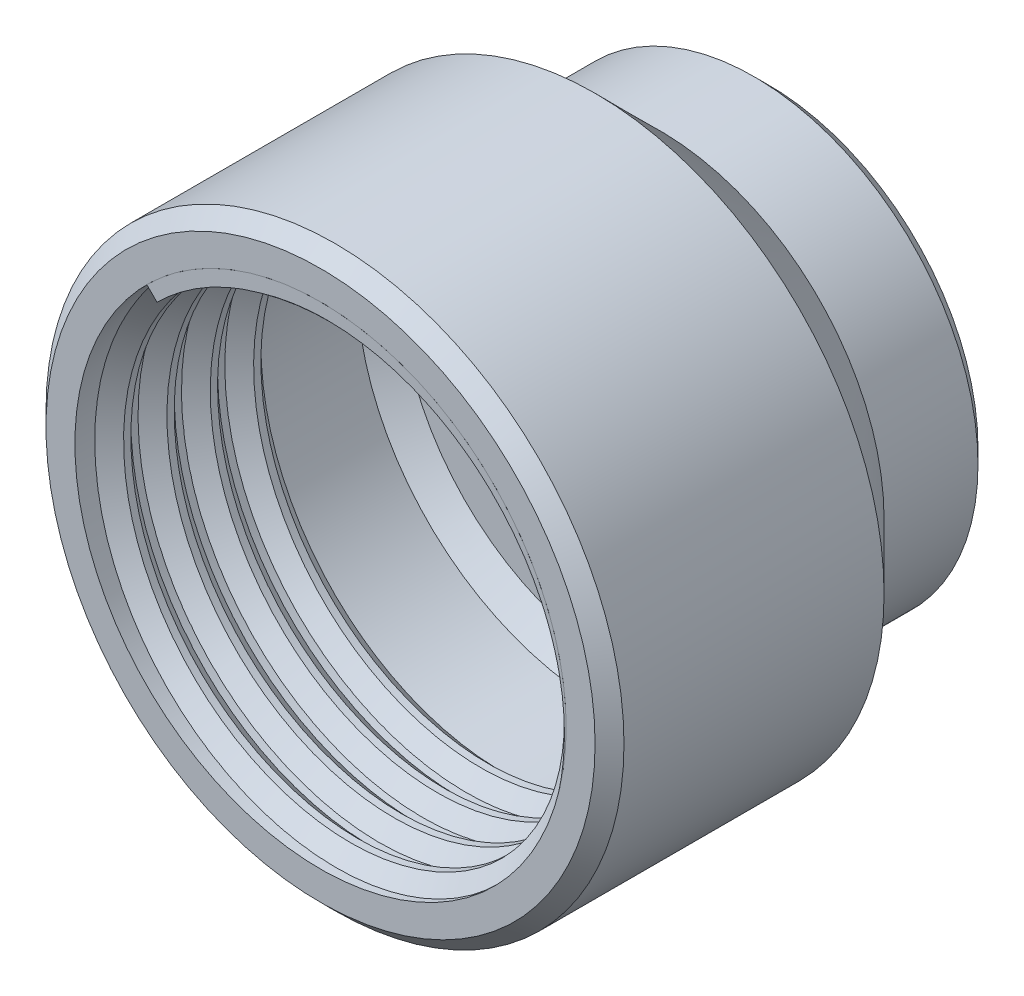
from build123d import *

# Parameters (mm, degrees)
SKETCH_1_R          = 15.5
SKETCH_1_R_2        = 9.6
EXTRUDE_1_DEPTH     = 10
CHAMFER_1_SIZE      = 3
SKETCH_2_R          = 20
SKETCH_2_R_2        = 17
EXTRUDE_2_DEPTH     = 24
SWEEP_1_PITCH       = 3
SWEEP_1_HEIGHT      = 12
SWEEP_1_RADIUS      = 17
SWEEP_1_START_ANGLE = 45
CHAMFER_3_SIZE      = 1
SKETCH_9_R          = 20
SKETCH_9_R_2        = 15.5
EXTRUDE_3_DEPTH     = 3
CHAMFER_4_SIZE      = 5
CHAMFER_5_SIZE      = 1.5
SKETCH_8_R          = 26.451480593
CUT_EXTRUDE_2_DEPTH = 15
CHAMFER_6_SIZE      = 1


with BuildPart() as part:
    # 草图1 → 凸台-拉伸1 (new body)
    with BuildSketch(Plane.XY):
        Circle(SKETCH_1_R)
        Circle(SKETCH_1_R_2, mode=Mode.SUBTRACT)
    extrude(amount=EXTRUDE_1_DEPTH)

    # 倒角1
    chamfer_1_edges = [part.edges().sort_by_distance(p)[0] for p in [
        (-9.6, 0, 10),
    ]]
    chamfer(chamfer_1_edges, length=CHAMFER_1_SIZE)

    # 倒角3
    chamfer_3_edges = [part.edges().sort_by_distance(p)[0] for p in [
        (-15.5, 0, 0),
        (-9.6, 0, 0),
    ]]
    chamfer(chamfer_3_edges, length=CHAMFER_3_SIZE)



with BuildPart() as body_2:
    # 草图2 → 凸台-拉伸2 (new body)
    with BuildSketch(Plane.XY.offset(7)):
        Circle(SKETCH_2_R)
        Circle(SKETCH_2_R_2, mode=Mode.SUBTRACT)
    extrude(amount=EXTRUDE_2_DEPTH)


with BuildPart() as body_3:
    # 扫描1: sweep along a helix
    with BuildLine() as sweep_1_path:
        add(Helix(SWEEP_1_PITCH, SWEEP_1_HEIGHT, SWEEP_1_RADIUS, center=(0, 0, 31), direction=(0, 0, -1), mode=Mode.PRIVATE).rotate(Axis((0, 0, 31), (0, 0, -1)), SWEEP_1_START_ANGLE))
    # 草图7 → 扫描1 (sweep)
    with BuildSketch(Plane(origin=(-12.02081528, 12.02081528, 19), x_dir=(-0.019852090292853706, -0.01985209029285167, -0.9996058168208152), z_dir=(0.7068280515875524, 0.7068280515874802, -0.028075095333607542))):
        Polygon((-1.25, 0), (1.25, 0), (0.25, -1), (-0.25, -1), align=None)
    sweep(path=sweep_1_path.line, is_frenet=True)

    # 草图8 → 切除-拉伸2 (cut)
    with BuildSketch(Plane.XY.offset(31)):
        with Locations((0.309153209, 0)):
            Circle(SKETCH_8_R)
    extrude(amount=CUT_EXTRUDE_2_DEPTH, mode=Mode.SUBTRACT)


with BuildPart() as part_1:
    add(part.part)

    add(body_2.part)  # 凸台-拉伸3 merges body 2
    # 草图9 → 凸台-拉伸3 (add)
    with BuildSketch(Plane(origin=(0, 0, 7), x_dir=(-1, 0, 0), z_dir=(0, 0, -1))):
        Circle(SKETCH_9_R)
        Circle(SKETCH_9_R_2, mode=Mode.SUBTRACT)
    extrude(amount=-EXTRUDE_3_DEPTH)

    # 倒角4
    # the kernel refuses this chamfer: 5 mm, written as the material it takes off along each edge
    with BuildSketch(Plane(origin=(0, 0, 7), x_dir=(1, 0, 0), z_dir=(0, 1, 0))) as chamfer_4_piece_1_section:
        Polygon((20, -CHAMFER_4_SIZE), (20 - CHAMFER_4_SIZE, 0), (20, 0), align=None)
    chamfer_4_piece_1 = revolve(axis=Axis((0, 0, 7), (0, 0, -1)), mode=Mode.PRIVATE)
    chamfer_4_piece_1 = chamfer_4_piece_1 - Plane(origin=(0, 0, 9.738671774), x_dir=(1, 0, 0), z_dir=(0, 0, -1)) * Cylinder(15.5, 80, mode=Mode.PRIVATE)
    add(chamfer_4_piece_1, mode=Mode.SUBTRACT)

    # 倒角5
    chamfer_5_edges = [part_1.edges().sort_by_distance(p)[0] for p in [
        (-17, 0, 10),
    ]]
    chamfer(chamfer_5_edges, length=CHAMFER_5_SIZE)

    # 倒角6
    chamfer_6_edges = [part_1.edges().sort_by_distance(p)[0] for p in [
        (-20, 0, 31),
    ]]
    chamfer(chamfer_6_edges, length=CHAMFER_6_SIZE)


solid = Compound([body_3.part, part_1.part])
